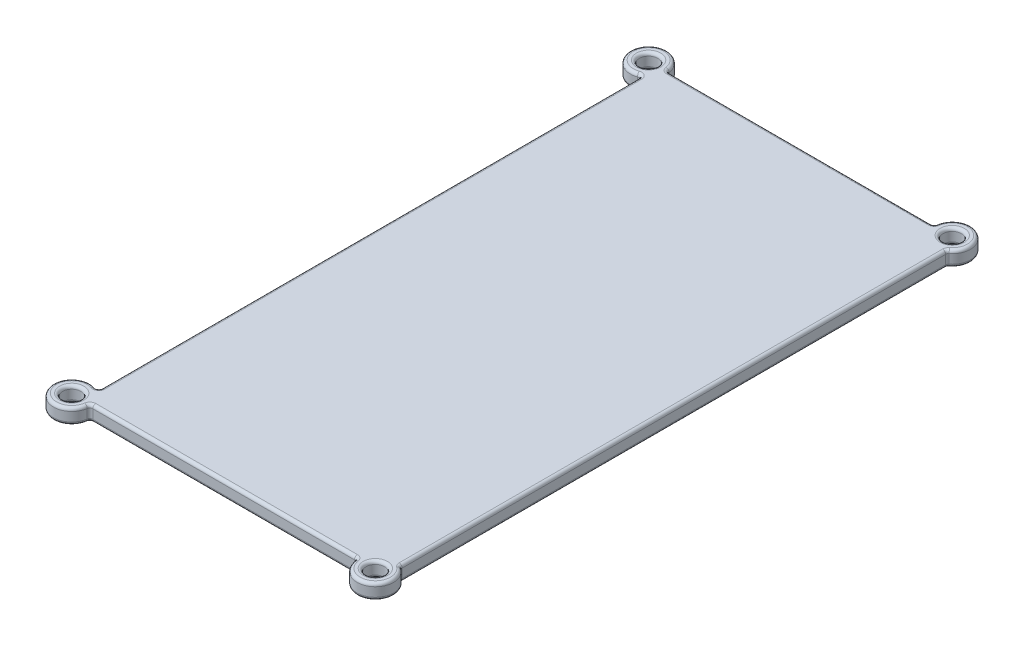
from build123d import *

# Parameters (mm, degrees)
SKETCH4_R           = 1.5
BOSS_EXTRUDE3_DEPTH = 2.5
FILLET1_R           = 0.5


with BuildPart() as part:
    # Sketch4 → Boss-Extrude3 (new body)
    with BuildSketch(Plane(origin=(0, 0, 0), x_dir=(1, 0, 0), z_dir=(0, 1, 0))):
        with BuildLine():
            Line((-22, 47.5), (22, 47.5))
            ThreePointArc((22, 47.5), (26.418637165, 50.143382037), (26.658312395, 45))
            Line((26.658312395, 45), (26.658312395, -45))
            ThreePointArc((26.658312395, -45), (26.418637165, -50.143382037), (22, -47.5))
            Line((22, -47.5), (-22, -47.5))
            ThreePointArc((-22, -47.5), (-27.643382037, -48.918637165), (-23.341687605, -45))
            Line((-23.341687605, -45), (-23.341687605, 45))
            ThreePointArc((-23.341687605, 45), (-27.643382037, 48.918637165), (-22, 47.5))
        make_face()
        with Locations((-25, 47.5)):
            Circle(SKETCH4_R, mode=Mode.SUBTRACT)
        with Locations((25, 47.5)):
            Circle(SKETCH4_R, mode=Mode.SUBTRACT)
        with Locations((25, -47.5)):
            Circle(SKETCH4_R, mode=Mode.SUBTRACT)
        with Locations((-25, -47.5)):
            Circle(SKETCH4_R, mode=Mode.SUBTRACT)
    extrude(amount=BOSS_EXTRUDE3_DEPTH)

    # Fillet1
    fillet1_edges = [part.edges().sort_by_distance(p)[0] for p in [
        (26.658312395, 1.25, -45),
        (22, 1.25, -47.5),
        (-22, 1.25, -47.5),
        (26.658312395, 1.25, 45),
        (22, 1.25, 47.5),
        (-22, 1.25, 47.5),
        (-23.341687605, 1.25, -45),
        (-23.341687605, 1.25, 45),
        (-26.5, 0, 47.5),
        (23.5, 0, 47.5),
        (23.5, 0, -47.5),
        (-26.5, 0, -47.5),
        (-23.341687605, 0, 0),
        (-27.643382037, 0, 48.918637165),
        (0, 0, 47.5),
        (26.418637165, 0, 50.143382037),
        (26.658312395, 0, 0),
        (26.418637165, 0, -50.143382037),
        (0, 0, -47.5),
        (-27.643382037, 0, -48.918637165),
        (-26.5, 2.5, 47.5),
        (23.5, 2.5, -47.5),
        (0, 2.5, -47.5),
        (26.418637165, 2.5, -50.143382037),
        (26.658312395, 2.5, 0),
        (26.418637165, 2.5, 50.143382037),
        (0, 2.5, 47.5),
        (-27.643382037, 2.5, 48.918637165),
        (-23.341687605, 2.5, 0),
        (-27.643382037, 2.5, -48.918637165),
        (-26.5, 2.5, -47.5),
        (23.5, 2.5, 47.5),
    ]]
    fillet(fillet1_edges, radius=FILLET1_R)


solid = part.part
